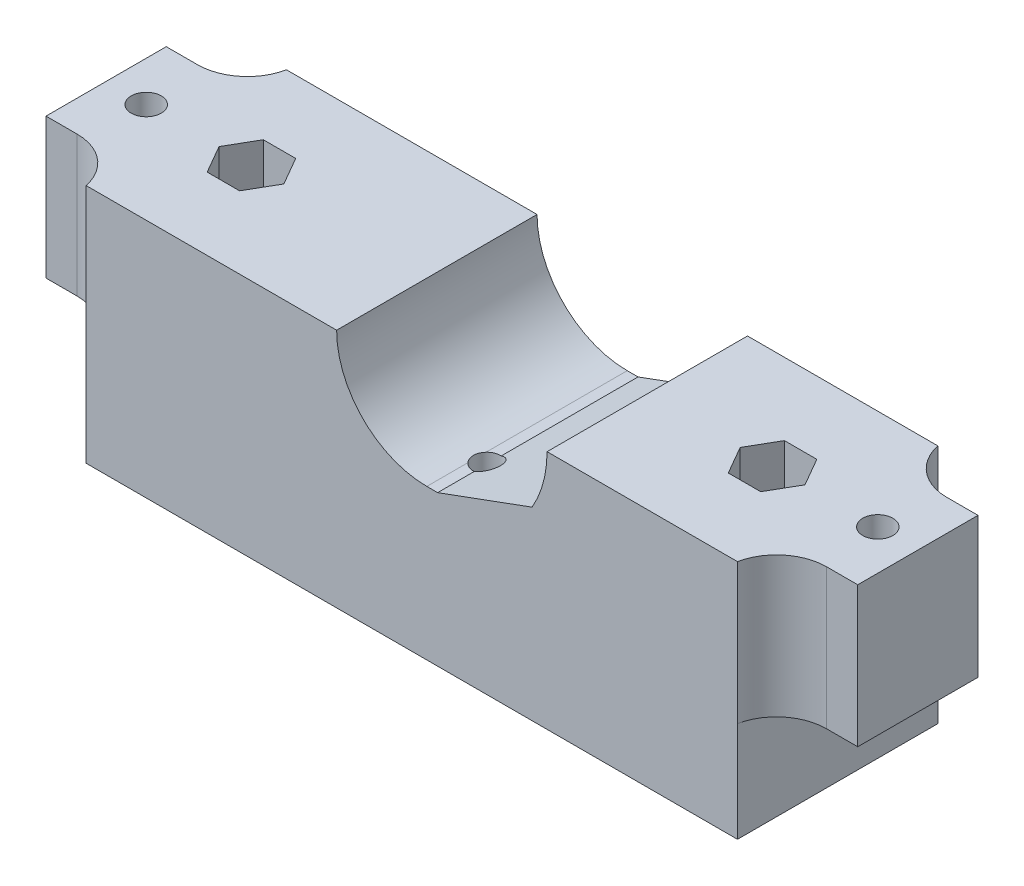
from build123d import *

# Parameters (mm, degrees)
SKETCH_1_W           = 60
SKETCH_1_H           = 34
EXTRUDE_1_DEPTH      = 20
CUT_EXTRUDE_8_DEPTH  = 66
SKETCH_20_W          = 5
SKETCH_20_H          = 34
EXTRUDE_7_DEPTH      = 20
SKETCH_22_W          = 65
SKETCH_22_H          = 20
EXTRUDE_8_DEPTH      = 7
SKETCH_21_R          = 1.5
CUT_EXTRUDE_13_DEPTH = 58.497826046
CUT_EXTRUDE_START    = -41
SKETCH_23_W          = 65
SKETCH_23_H          = 20
CUT_EXTRUDE_14_DEPTH = 17
CUT_EXTRUDE_16_DEPTH = 4.2
SKETCH_27_W          = 8
SKETCH_27_H          = 12
EXTRUDE_10_DEPTH     = 14
SKETCH_30_R          = 1.5
CUT_EXTRUDE_18_DEPTH = 54.150729064
FILLET_6_R           = 5
CUT_EXTRUDE_22_DEPTH = 5
SKETCH_36_R          = 1.35
CUT_EXTRUDE_23_DEPTH = 54.150729064


with BuildPart() as part:
    # 草图1 → 凸台-拉伸1 (new body)
    with BuildSketch(Plane.XY):
        Rectangle(SKETCH_1_W, SKETCH_1_H)
    extrude(amount=EXTRUDE_1_DEPTH)

    # 草图19 → 切除-拉伸8 (cut)
    with BuildSketch(Plane.XY.offset(20)):
        with BuildLine():
            Line((0, 9), (-1, 9))
            ThreePointArc((-1, 9), (-10, 0), (-1, -9))
            Line((-1, -9), (0.07899986, -9))
            Line((0.07899986, -9), (9.502211487, -5.541477859))
            ThreePointArc((9.502211487, -5.541477859), (11, 0), (9.502211487, 5.541477859))
            Line((9.502211487, 5.541477859), (0, 9))
        make_face()
    extrude(amount=-CUT_EXTRUDE_8_DEPTH, mode=Mode.SUBTRACT)

    # 草图20 → 凸台-拉伸7 (add)
    with BuildSketch(Plane.XY.offset(20)):
        with Locations((-32.5, 0)):
            Rectangle(SKETCH_20_W, SKETCH_20_H)
    extrude(amount=-EXTRUDE_7_DEPTH)

    # 草图22 → 凸台-拉伸8 (add)
    with BuildSketch(Plane.XZ.offset(17)):
        with Locations((-2.5, 10)):
            Rectangle(SKETCH_22_W, SKETCH_22_H)
    extrude(amount=EXTRUDE_8_DEPTH)

    # 草图21 → 切除-拉伸13 (cut, through all)
    with BuildSketch(Plane.XZ.offset(-17)):
        with Locations(Location((-28.5, 10, 0), (0, 0, 90))):
            Circle(SKETCH_21_R)
        with Locations(Location((23.5, 10, 0), (0, 0, 270))):
            Circle(SKETCH_21_R)
    extrude(amount=CUT_EXTRUDE_13_DEPTH, mode=Mode.SUBTRACT)

    # 草图23 → 切除-拉伸14 (cut)
    with BuildSketch(Plane.XZ.offset(24).offset(CUT_EXTRUDE_START)):
        with Locations((-2.5, 10)):
            Rectangle(SKETCH_23_W, SKETCH_23_H)
    extrude(amount=CUT_EXTRUDE_14_DEPTH, mode=Mode.SUBTRACT)

    # 草图25 → 切除-拉伸16 (cut)
    with BuildSketch(Plane(origin=(0, 0, 0), x_dir=(1, 0, 0), z_dir=(0, 1, 0))):
        Polygon((26.733161507, -10), (25.116580754, -7.2), (21.883419246, -7.2), (20.266838493, -10), (21.883419246, -12.8), (25.116580754, -12.8), align=None)
        Polygon((-25.266838493, -10), (-26.883419246, -7.2), (-30.116580754, -7.2), (-31.733161507, -10), (-30.116580754, -12.8), (-26.883419246, -12.8), align=None)
    extrude(amount=-CUT_EXTRUDE_16_DEPTH, mode=Mode.SUBTRACT)

    # 草图27 → 凸台-拉伸10 (add)
    with BuildSketch(Plane(origin=(0, 0, 0), x_dir=(1, 0, 0), z_dir=(0, 1, 0))):
        with Locations((34, -10)):
            Rectangle(SKETCH_27_W, SKETCH_27_H)
        with Locations((-39, -10)):
            Rectangle(SKETCH_27_W, SKETCH_27_H)
    extrude(amount=-EXTRUDE_10_DEPTH)

    # 草图30 → 切除-拉伸18 (cut, through all)
    with BuildSketch(Plane(origin=(0, 0, 0), x_dir=(1, 0, 0), z_dir=(0, 1, 0))):
        with Locations(Location((34, -10, 0), (0, 0, 270))):
            Circle(SKETCH_30_R)
        with Locations(Location((-39, -10, 0), (0, 0, 270))):
            Circle(SKETCH_30_R)
    extrude(amount=-CUT_EXTRUDE_18_DEPTH, mode=Mode.SUBTRACT)

    # 圆角6
    # the kernel refuses this fillet: 5 mm, written as the material it adds along each edge
    with BuildSketch(Plane(origin=(-35, 0, 4), x_dir=(-1.5685230891899147e-12, 0, -1.0), z_dir=(0, -1, 0)), Plane(origin=(30, 0, 16), x_dir=(1.5978329770400045e-12, 0, 1.0), z_dir=(0, -1, 0))) as fillet_6_piece_1:
        with BuildLine():
            CenterArc((5, -4.898979486), FILLET_6_R, 101.536959033, 78.463040967)
            Line((0, -4.898979486), (-0.1, -4.898979486))
            Line((-0.1, -4.898979486), (-0.1, 0))
            Line((-0.1, 0), (0, 0.1))
            ThreePointArc((0, 0.1), (2, 0.1), (3.98, 0.09797959))
            Line((3.98, 0.09797959), (4, 0))
        make_face()
    extrude(amount=14)
    with BuildSketch(Plane(origin=(-35, 0, 16), x_dir=(-1.596944798620306e-12, 0, 1.0), z_dir=(0, -1, 0)), Plane(origin=(30, 0, 4), x_dir=(1.5702994460293186e-12, 0, -1.0), z_dir=(0, -1, 0))) as fillet_6_piece_2:
        with BuildLine():
            CenterArc((5, 4.898979486), FILLET_6_R, 180, 78.463040967)
            Line((0, 4.898979486), (-0.1, 4.898979486))
            Line((-0.1, 4.898979486), (-0.1, 0))
            Line((-0.1, 0), (0, -0.1))
            ThreePointArc((0, -0.1), (2, -0.1), (3.98, -0.09797959))
            Line((3.98, -0.09797959), (4, 0))
        make_face()
    extrude(amount=14)

    # 草图35 → 切除-拉伸22 (cut)
    with BuildSketch(Plane.XZ.offset(14)):
        Polygon((37.117691454, 10), (35.558845727, 12.7), (32.441154273, 12.7), (30.882308546, 10), (32.441154273, 7.3), (35.558845727, 7.3), align=None)
        Polygon((-35.882308546, 10), (-37.441154273, 12.7), (-40.558845727, 12.7), (-42.117691454, 10), (-40.558845727, 7.3), (-37.441154273, 7.3), align=None)
    extrude(amount=-CUT_EXTRUDE_22_DEPTH, mode=Mode.SUBTRACT)

    # 草图36 → 切除-拉伸23 (cut, through all)
    with BuildSketch(Plane.XZ.offset(24)):
        with Locations(Location((0, 15, 0), (0, 0, 270))):
            Circle(SKETCH_36_R)
    extrude(amount=-CUT_EXTRUDE_23_DEPTH, mode=Mode.SUBTRACT)


solid = part.part
